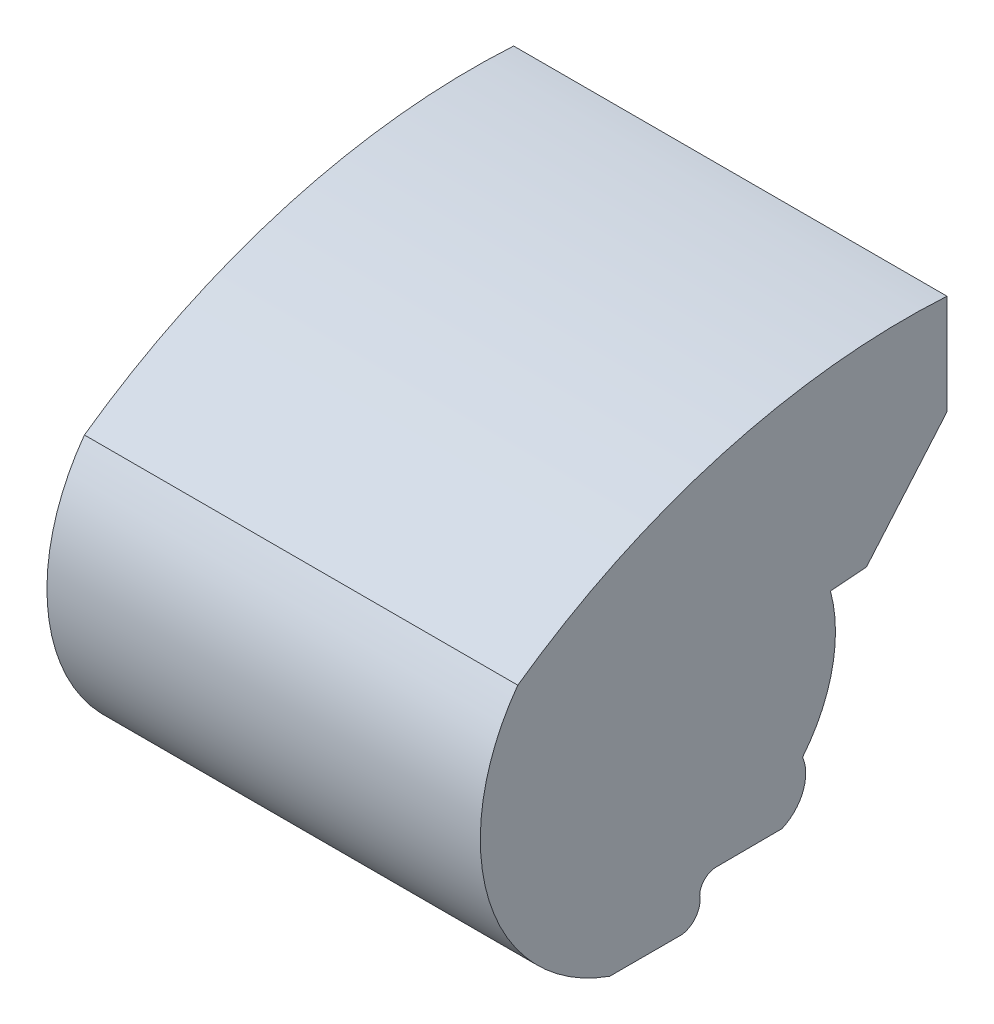
from build123d import *

# Parameters (mm, degrees)
BOSS_EXTRUDE1_DEPTH = 42
CUT_EXTRUDE1_DEPTH  = 19


with BuildPart() as part:
    # Sketch2 → Boss-Extrude1 (new body)
    with BuildSketch(Plane(origin=(330, 0, 0), x_dir=(0, 0, -1), z_dir=(1, 0, 0))):
        with BuildLine():
            Line((-2.62e-07, 373.656829834), (-7.80990307, 364.520104654))
            Line((-7.80990307, 364.520104654), (-11.29720968, 364.247068837))
            ThreePointArc((-11.29720968, 364.247068837), (-11.127046978, 357.62531121), (-14.000000856, 351.656830212))
            ThreePointArc((-14.000000856, 351.656830212), (-13.964466435, 348.742616634), (-16, 346.656829834))
            Line((-16, 346.656829834), (-22.363925934, 346.623443604))
            ThreePointArc((-22.363925934, 346.623443604), (-23.494738089, 346.151565793), (-23.966611862, 345.020751953))
            ThreePointArc((-23.966611862, 345.020751953), (-24.308596388, 343.469721718), (-25.647159962, 342.614797297))
            Line((-25.647159962, 342.614797297), (-32.682253786, 342.614797297))
            ThreePointArc((-32.682253786, 342.614797297), (-44.390566024, 354.820843807), (-41.600177765, 371.502746582))
            ThreePointArc((-41.600177765, 371.502746582), (-21.812698495, 380.981943134), (-2.62e-07, 383.349578857))
            Line((-2.62e-07, 383.349578857), (-2.62e-07, 373.656829834))
        make_face()
    extrude(amount=BOSS_EXTRUDE1_DEPTH)

    # Sketch3 → Cut-Extrude1 (cut, symmetric)
    with BuildSketch(Plane(origin=(351, 0, 0), x_dir=(0, 0, -1), z_dir=(1, 0, 0))):
        with BuildLine():
            Line((-2.62e-07, 373.656829834), (-7.80990307, 364.520104654))
            Line((-7.80990307, 364.520104654), (-11.29720968, 364.247068837))
            ThreePointArc((-11.29720968, 364.247068837), (-11.127046978, 357.62531121), (-14.000000856, 351.656830212))
            ThreePointArc((-14.000000856, 351.656830212), (-13.964466435, 348.742616634), (-16, 346.656829834))
            Line((-16, 346.656829834), (-22.363925934, 346.623443604))
            ThreePointArc((-22.363925934, 346.623443604), (-23.494738089, 346.151565793), (-23.966611862, 345.020751953))
            ThreePointArc((-23.966611862, 345.020751953), (-23.936866237, 344.562585137), (-24.008594726, 344.109091302))
            Line((-24.008594726, 344.109091302), (-33.090832936, 344.109091302))
            ThreePointArc((-33.090832936, 344.109091302), (-42.539198891, 355.553129581), (-40.779046319, 370.288783427))
            ThreePointArc((-40.779046319, 370.288783427), (-21.396409917, 379.710238155), (-2.62e-07, 382.287844983))
            Line((-2.62e-07, 382.287844983), (-2.62e-07, 373.656829834))
        make_face()
    extrude(amount=CUT_EXTRUDE1_DEPTH, both=True, mode=Mode.SUBTRACT)


solid = part.part
